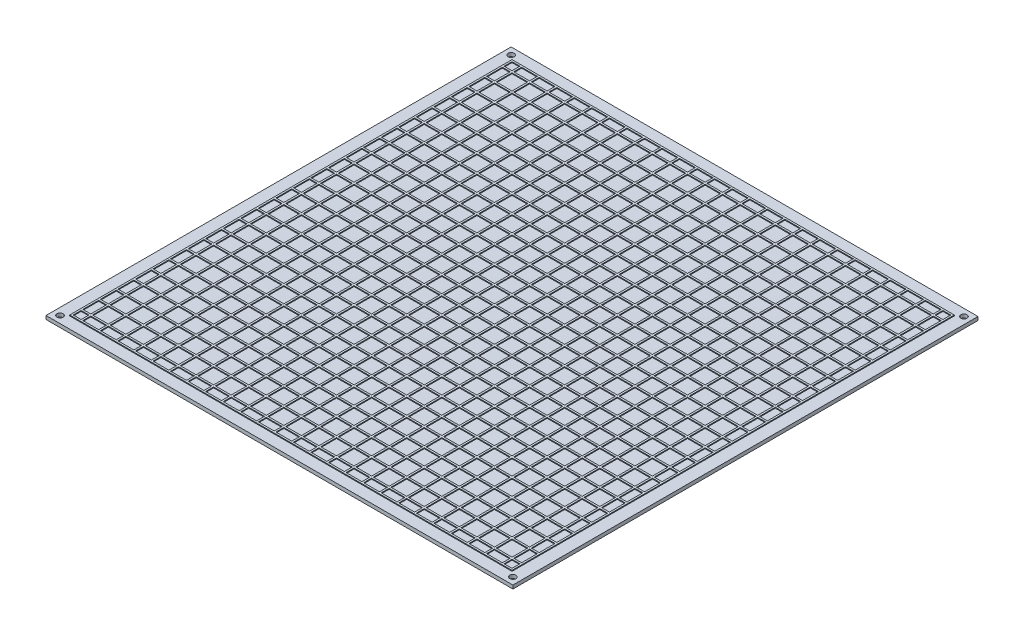
from build123d import *

# Parameters (mm, degrees)
SKETCH_1_W               = 266
SKETCH_1_H               = 265
SKETCH_1_R               = 1.75
EXTRUDE_1_DEPTH          = 2
ESBO_O1_W                = 252
ESBO_O1_H                = 252
ESBO_O1_W_2              = 4.5
ESBO_O1_H_2              = 250
ESBO_O1_W_3              = 9
RESSALTO_EXTRUS_O1_DEPTH = 0.5
ESBO_O2_W                = 251
ESBO_O2_H                = 1
ESBO_O2_W_2              = 252
RESSALTO_EXTRUS_O4_DEPTH = 0.5


with BuildPart() as part:
    # Эскиз1 → Бобышка-Вытянуть1 (new body)
    with BuildSketch(Plane(origin=(0, 0, 0), x_dir=(1, 0, 0), z_dir=(0, 1, 0))):
        Rectangle(SKETCH_1_W, SKETCH_1_H)
        with Locations((-129, 128.5)):
            Circle(SKETCH_1_R, mode=Mode.SUBTRACT)
        with Locations((129, 128.5)):
            Circle(SKETCH_1_R, mode=Mode.SUBTRACT)
        with Locations((129, -128.5)):
            Circle(SKETCH_1_R, mode=Mode.SUBTRACT)
        with Locations((-129, -128.5)):
            Circle(SKETCH_1_R, mode=Mode.SUBTRACT)
    extrude(amount=EXTRUDE_1_DEPTH)

    # Esboço1 → Ressalto-extrusão1 (add)
    with BuildSketch(Plane(origin=(0, 2, 0), x_dir=(1, 0, 0), z_dir=(0, 1, 0))):
        Rectangle(ESBO_O1_W, ESBO_O1_H)
        with Locations((-122.75, 0)):
            Rectangle(ESBO_O1_W_2, ESBO_O1_H_2, mode=Mode.SUBTRACT)
        with Locations((122.75, 0)):
            Rectangle(ESBO_O1_W_2, ESBO_O1_H_2, mode=Mode.SUBTRACT)
        with Locations((-5, 0)):
            Rectangle(ESBO_O1_W_3, ESBO_O1_H_2, mode=Mode.SUBTRACT)
        with Locations((5, 0)):
            Rectangle(ESBO_O1_W_3, ESBO_O1_H_2, mode=Mode.SUBTRACT)
        with Locations((15, 0)):
            Rectangle(ESBO_O1_W_3, ESBO_O1_H_2, mode=Mode.SUBTRACT)
        with Locations((25, 0)):
            Rectangle(ESBO_O1_W_3, ESBO_O1_H_2, mode=Mode.SUBTRACT)
        with Locations((35, 0)):
            Rectangle(ESBO_O1_W_3, ESBO_O1_H_2, mode=Mode.SUBTRACT)
        with Locations((45, 0)):
            Rectangle(ESBO_O1_W_3, ESBO_O1_H_2, mode=Mode.SUBTRACT)
        with Locations((55, 0)):
            Rectangle(ESBO_O1_W_3, ESBO_O1_H_2, mode=Mode.SUBTRACT)
        with Locations((65, 0)):
            Rectangle(ESBO_O1_W_3, ESBO_O1_H_2, mode=Mode.SUBTRACT)
        with Locations((75, 0)):
            Rectangle(ESBO_O1_W_3, ESBO_O1_H_2, mode=Mode.SUBTRACT)
        with Locations((85, 0)):
            Rectangle(ESBO_O1_W_3, ESBO_O1_H_2, mode=Mode.SUBTRACT)
        with Locations((95, 0)):
            Rectangle(ESBO_O1_W_3, ESBO_O1_H_2, mode=Mode.SUBTRACT)
        with Locations((105, 0)):
            Rectangle(ESBO_O1_W_3, ESBO_O1_H_2, mode=Mode.SUBTRACT)
        with Locations((115, 0)):
            Rectangle(ESBO_O1_W_3, ESBO_O1_H_2, mode=Mode.SUBTRACT)
        with Locations((-115, 0)):
            Rectangle(ESBO_O1_W_3, ESBO_O1_H_2, mode=Mode.SUBTRACT)
        with Locations((-105, 0)):
            Rectangle(ESBO_O1_W_3, ESBO_O1_H_2, mode=Mode.SUBTRACT)
        with Locations((-95, 0)):
            Rectangle(ESBO_O1_W_3, ESBO_O1_H_2, mode=Mode.SUBTRACT)
        with Locations((-85, 0)):
            Rectangle(ESBO_O1_W_3, ESBO_O1_H_2, mode=Mode.SUBTRACT)
        with Locations((-75, 0)):
            Rectangle(ESBO_O1_W_3, ESBO_O1_H_2, mode=Mode.SUBTRACT)
        with Locations((-65, 0)):
            Rectangle(ESBO_O1_W_3, ESBO_O1_H_2, mode=Mode.SUBTRACT)
        with Locations((-55, 0)):
            Rectangle(ESBO_O1_W_3, ESBO_O1_H_2, mode=Mode.SUBTRACT)
        with Locations((-45, 0)):
            Rectangle(ESBO_O1_W_3, ESBO_O1_H_2, mode=Mode.SUBTRACT)
        with Locations((-35, 0)):
            Rectangle(ESBO_O1_W_3, ESBO_O1_H_2, mode=Mode.SUBTRACT)
        with Locations((-25, 0)):
            Rectangle(ESBO_O1_W_3, ESBO_O1_H_2, mode=Mode.SUBTRACT)
        with Locations((-15, 0)):
            Rectangle(ESBO_O1_W_3, ESBO_O1_H_2, mode=Mode.SUBTRACT)
    extrude(amount=RESSALTO_EXTRUS_O1_DEPTH)

    # Esboço2 → Ressalto-extrusão4 (add)
    with BuildSketch(Plane(origin=(0, 2, 0), x_dir=(1, 0, 0), z_dir=(0, 1, 0))):
        with Locations((0.5, 120)):
            Rectangle(ESBO_O2_W, ESBO_O2_H)
        with Locations((0, 110)):
            Rectangle(ESBO_O2_W_2, ESBO_O2_H)
        with Locations((0, 100)):
            Rectangle(ESBO_O2_W_2, ESBO_O2_H)
        with Locations((0, 90)):
            Rectangle(ESBO_O2_W_2, ESBO_O2_H)
        with Locations((0.5, 80)):
            Rectangle(ESBO_O2_W, ESBO_O2_H)
        with Locations((0.5, 70)):
            Rectangle(ESBO_O2_W, ESBO_O2_H)
        with Locations((0, 60)):
            Rectangle(ESBO_O2_W_2, ESBO_O2_H)
        with Locations((0.5, 50)):
            Rectangle(ESBO_O2_W, ESBO_O2_H)
        with Locations((0.5, 40)):
            Rectangle(ESBO_O2_W, ESBO_O2_H)
        with Locations((0.5, 30)):
            Rectangle(ESBO_O2_W, ESBO_O2_H)
        with Locations((0, 20)):
            Rectangle(ESBO_O2_W_2, ESBO_O2_H)
        with Locations((0.5, 10)):
            Rectangle(ESBO_O2_W, ESBO_O2_H)
        with Locations((0, -120)):
            Rectangle(ESBO_O2_W_2, ESBO_O2_H)
        with Locations((0, -110)):
            Rectangle(ESBO_O2_W_2, ESBO_O2_H)
        with Locations((0, -100)):
            Rectangle(ESBO_O2_W_2, ESBO_O2_H)
        with Locations((0, -90)):
            Rectangle(ESBO_O2_W_2, ESBO_O2_H)
        with Locations((0, -80)):
            Rectangle(ESBO_O2_W_2, ESBO_O2_H)
        with Locations((0, -70)):
            Rectangle(ESBO_O2_W_2, ESBO_O2_H)
        with Locations((0, -60)):
            Rectangle(ESBO_O2_W_2, ESBO_O2_H)
        with Locations((0, -50)):
            Rectangle(ESBO_O2_W_2, ESBO_O2_H)
        with Locations((0, -40)):
            Rectangle(ESBO_O2_W_2, ESBO_O2_H)
        with Locations((0, -30)):
            Rectangle(ESBO_O2_W_2, ESBO_O2_H)
        with Locations((0.5, -20)):
            Rectangle(ESBO_O2_W, ESBO_O2_H)
        with Locations((0.5, -10)):
            Rectangle(ESBO_O2_W, ESBO_O2_H)
        with Locations((0.5, 0)):
            Rectangle(ESBO_O2_W, ESBO_O2_H)
    extrude(amount=RESSALTO_EXTRUS_O4_DEPTH)


solid = part.part
